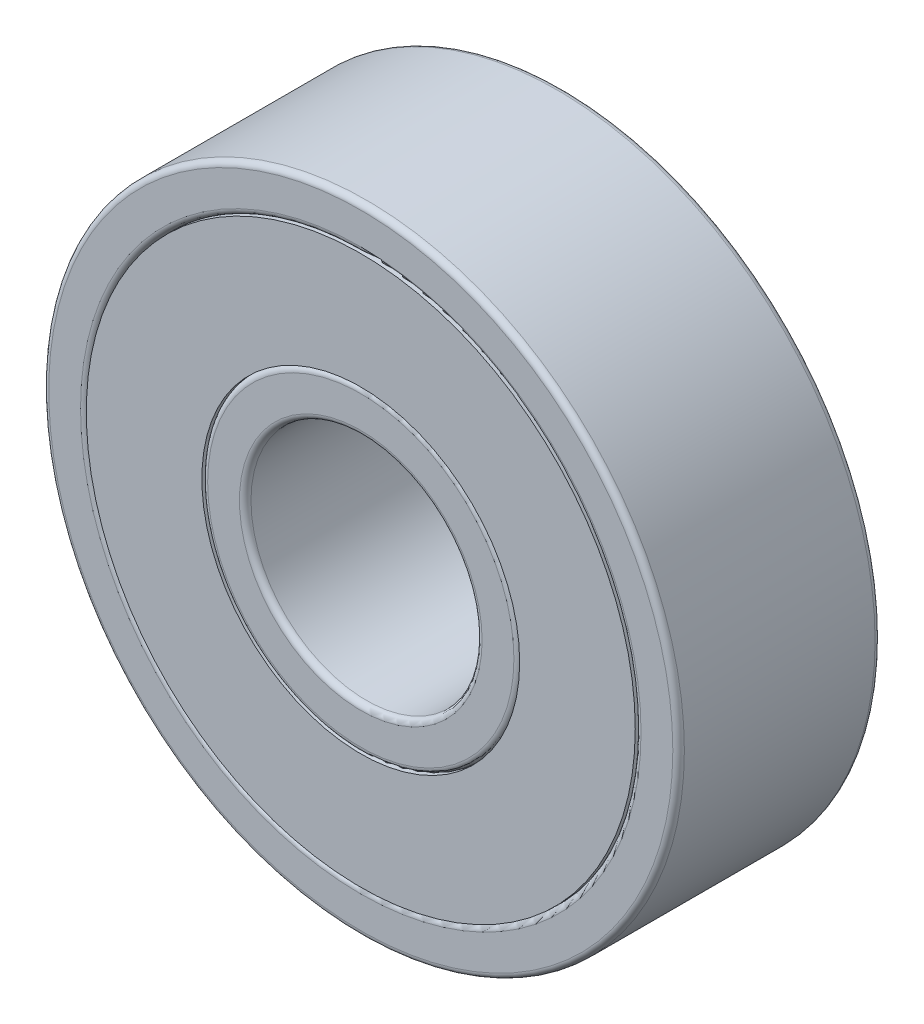
from build123d import *

# Parameters (mm, degrees)
SKETCH1_R             = 11
SKETCH1_R_2           = 9.5
BOSS_EXTRUDE1_DEPTH   = 7
SKETCH1_R_3           = 5.5
SKETCH1_R_4           = 4
BOSS_EXTRUDE1_2_DEPTH = 7
SKETCH1_3_R           = 9.5
SKETCH1_3_R_2         = 5.5
BOSS_EXTRUDE2_DEPTH   = 7
FILLET1_R             = 0.2
FILLET2_R             = 0.2


with BuildPart() as part:
    # Sketch1 → Boss-Extrude1 (new body)
    with BuildSketch(Plane.XY):
        Circle(SKETCH1_R)
        Circle(SKETCH1_R_2, mode=Mode.SUBTRACT)
    extrude(amount=BOSS_EXTRUDE1_DEPTH)

    # Fillet1
    fillet1_edges = [part.edges().sort_by_distance(p)[0] for p in [
        (-11, 0, 0),
        (-9.5, 0, 0),
        (-11, 0, 7),
        (-9.5, 0, 7),
    ]]
    fillet(fillet1_edges, radius=FILLET1_R)


with BuildPart() as body_2:
    # Sketch1 → Boss-Extrude1 2 (new body)
    with BuildSketch(Plane.XY):
        Circle(SKETCH1_R_3)
        Circle(SKETCH1_R_4, mode=Mode.SUBTRACT)
    extrude(amount=BOSS_EXTRUDE1_2_DEPTH)

    # Fillet2
    fillet2_edges = [body_2.edges().sort_by_distance(p)[0] for p in [
        (-5.5, 0, 0),
        (-4, 0, 0),
        (-5.5, 0, 7),
        (-4, 0, 7),
    ]]
    fillet(fillet2_edges, radius=FILLET2_R)


with BuildPart() as body_3:
    # Sketch1<3> → Boss-Extrude2 (new body)
    with BuildSketch(Plane.XY):
        Circle(SKETCH1_3_R)
        Circle(SKETCH1_3_R_2, mode=Mode.SUBTRACT)
    extrude(amount=BOSS_EXTRUDE2_DEPTH)


solid = Compound([part.part, body_2.part, body_3.part])
